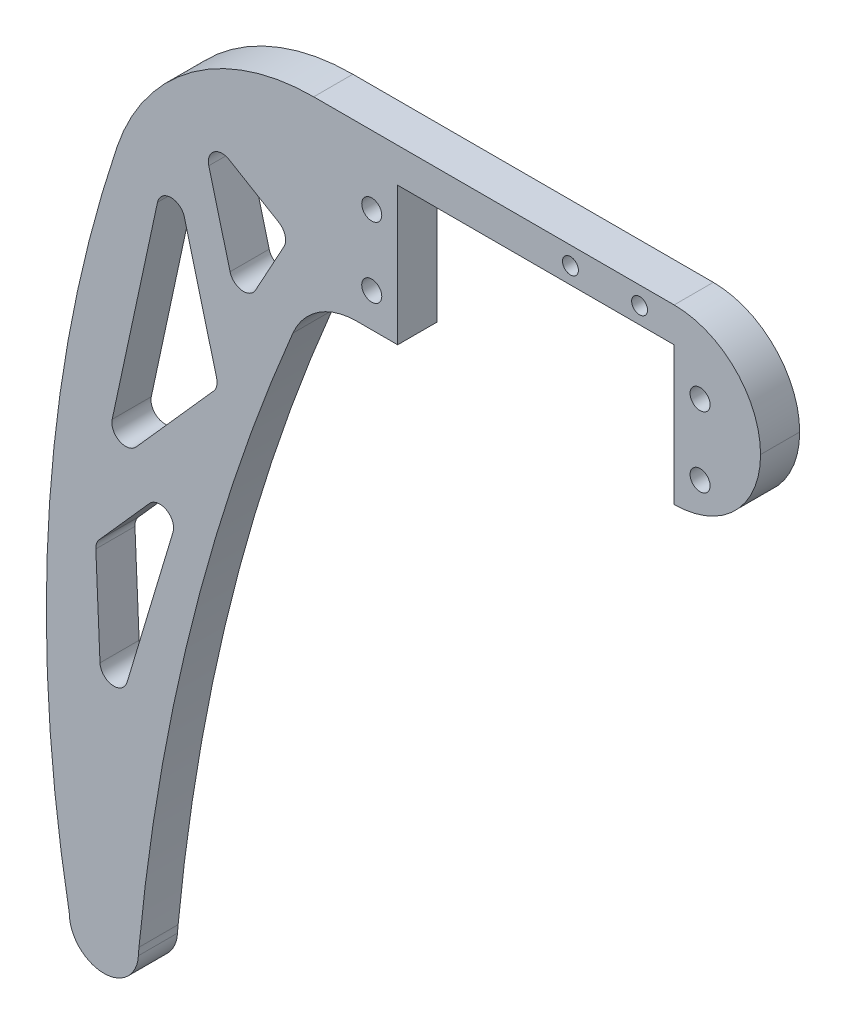
from build123d import *

# Parameters (mm, degrees)
BOSS_EXTRU_1_DEPTH      = 5.66
ENL_V_MAT_EXTRU_1_REACH = 135.062
ESQUISSE2_W             = 40
ESQUISSE2_H             = 20
ENL_V_MAT_EXTRU_2_REACH = 135.062
ESQUISSE3_R             = 1.45
CONG_2_R                = 12.5
CONG_3_R                = 10
CONG_4_R                = 30
CONG_5_R                = 30
ENL_V_MAT_EXTRU_3_REACH = 135.062
CONG_6_R                = 2
ENL_V_MAT_EXTRU_4_REACH = 135.062
ESQUISSE5_R             = 1.15


# Some blends are built 0.0001 mm under size
with BuildPart() as part:
    # Esquisse1 → Boss.-Extru.1 (new body)
    with BuildSketch(Plane.XY):
        with BuildLine():
            Line((-32.5, 12.5), (-52.5, 12.5))
            ThreePointArc((-52.5, 12.5), (-69.287355537, -46.339080558), (-67.5, -107.5))
            ThreePointArc((-67.5, -107.5), (-62.5, -112.5), (-57.5, -107.5))
            ThreePointArc((-57.5, -107.5), (-48.914858734, -58.969774017), (-32.5, -12.5))
            Line((-32.5, -12.5), (32.5, -12.5))
            Line((32.5, -12.5), (32.5, 12.5))
            Line((32.5, 12.5), (-32.5, 12.5))
        make_face()
    extrude(amount=BOSS_EXTRU_1_DEPTH)

    # Esquisse2 → Enlèv. mat.-Extru.1 (cut, up to next)
    with BuildSketch(Plane.XY.offset(5.66), mode=Mode.PRIVATE) as enl_v_mat_extru_1_sk1:
        with Locations((0, -2.5)):
            Rectangle(ESQUISSE2_W, ESQUISSE2_H)
    enl_v_mat_extru_1_tool1 = extrude(enl_v_mat_extru_1_sk1.sketch, amount=-ENL_V_MAT_EXTRU_1_REACH, mode=Mode.PRIVATE) & part.part
    add(enl_v_mat_extru_1_tool1.solids().sort_by_distance((0, -2.5, 5.66))[0], mode=Mode.SUBTRACT)

    # Esquisse3 → Enlèv. mat.-Extru.2 (cut, up to next)
    with BuildSketch(Plane.XY.offset(5.66), mode=Mode.PRIVATE) as enl_v_mat_extru_2_sk1:
        with Locations((-23.75, -7.58)):
            Circle(ESQUISSE3_R)
    enl_v_mat_extru_2_tool1 = extrude(enl_v_mat_extru_2_sk1.sketch, amount=-ENL_V_MAT_EXTRU_2_REACH, mode=Mode.PRIVATE) & part.part
    # Esquisse3 → Enlèv. mat.-Extru.2 (cut, up to next)
    with BuildSketch(Plane.XY.offset(5.66), mode=Mode.PRIVATE) as enl_v_mat_extru_2_sk2:
        with Locations((23.75, -7.58)):
            Circle(ESQUISSE3_R)
    enl_v_mat_extru_2_tool2 = extrude(enl_v_mat_extru_2_sk2.sketch, amount=-ENL_V_MAT_EXTRU_2_REACH, mode=Mode.PRIVATE) & part.part
    # Esquisse3 → Enlèv. mat.-Extru.2 (cut, up to next)
    with BuildSketch(Plane.XY.offset(5.66), mode=Mode.PRIVATE) as enl_v_mat_extru_2_sk3:
        with Locations((23.75, 2.58)):
            Circle(ESQUISSE3_R)
    enl_v_mat_extru_2_tool3 = extrude(enl_v_mat_extru_2_sk3.sketch, amount=-ENL_V_MAT_EXTRU_2_REACH, mode=Mode.PRIVATE) & part.part
    # Esquisse3 → Enlèv. mat.-Extru.2 (cut, up to next)
    with BuildSketch(Plane.XY.offset(5.66), mode=Mode.PRIVATE) as enl_v_mat_extru_2_sk4:
        with Locations((-23.75, 2.58)):
            Circle(ESQUISSE3_R)
    enl_v_mat_extru_2_tool4 = extrude(enl_v_mat_extru_2_sk4.sketch, amount=-ENL_V_MAT_EXTRU_2_REACH, mode=Mode.PRIVATE) & part.part
    add(enl_v_mat_extru_2_tool1.solids().sort_by_distance((-23.75, -7.58, 5.66))[0], mode=Mode.SUBTRACT)
    add(enl_v_mat_extru_2_tool2.solids().sort_by_distance((23.75, -7.58, 5.66))[0], mode=Mode.SUBTRACT)
    add(enl_v_mat_extru_2_tool3.solids().sort_by_distance((23.75, 2.58, 5.66))[0], mode=Mode.SUBTRACT)
    add(enl_v_mat_extru_2_tool4.solids().sort_by_distance((-23.75, 2.58, 5.66))[0], mode=Mode.SUBTRACT)

    # Congé2
    cong_2_edges = [part.edges().sort_by_distance(p)[0] for p in [
        (32.5, -12.5, 2.83),
        (32.5, 12.5, 2.83),
    ]]
    fillet(cong_2_edges, radius=CONG_2_R - 0.0001)  # a hair under: the kernel refuses the full size

    # Congé3
    cong_3_edges = [part.edges().sort_by_distance(p)[0] for p in [
        (-32.5, -12.5, 2.83),
    ]]
    fillet(cong_3_edges, radius=CONG_3_R)

    # Congé4
    cong_4_edges = [part.edges().sort_by_distance(p)[0] for p in [
        (-52.5, 12.5, 2.83),
    ]]
    fillet(cong_4_edges, radius=CONG_4_R)

    # Congé5
    # the kernel refuses this fillet: 30 mm, written as the material it adds along each edge
    with BuildSketch(Plane(origin=(-57.5, -107.5, 0), x_dir=(-0.029294676062998543, -0.9995708188789647, 0), z_dir=(0, 0, 1))) as cong_5_piece_1:
        with BuildLine():
            CenterArc((1.171787043, 29.987124566), CONG_5_R, 266.202223448, 2.119075089)
            ThreePointArc((-0.815268333, 0.053003384), (-0.407652209, 0.026224165), (0, 0))
            ThreePointArc((0, 0), (0.14647338, 0.002145906), (0.292946761, 0))
        make_face()
    extrude(amount=5.66)

    # Esquisse4 → Enlèv. mat.-Extru.3 (cut, up to next)
    with BuildSketch(Plane.XY.offset(5.66), mode=Mode.PRIVATE) as enl_v_mat_extru_3_sk1:
        Polygon((-35.530484253, -6.741676359), (-42.974151572, -20.332321303), (-48.555833289, 0.989708193), align=None)
    enl_v_mat_extru_3_tool1 = extrude(enl_v_mat_extru_3_sk1.sketch, amount=-ENL_V_MAT_EXTRU_3_REACH, mode=Mode.PRIVATE) & part.part
    # Esquisse4 → Enlèv. mat.-Extru.3 (cut, up to next)
    with BuildSketch(Plane.XY.offset(5.66), mode=Mode.PRIVATE) as enl_v_mat_extru_3_sk2:
        Polygon((-52.982896502, -3.816878406), (-45.919055028, -30.800759586), (-62.900626013, -49.913479621), align=None)
    enl_v_mat_extru_3_tool2 = extrude(enl_v_mat_extru_3_sk2.sketch, amount=-ENL_V_MAT_EXTRU_3_REACH, mode=Mode.PRIVATE) & part.part
    # Esquisse4 → Enlèv. mat.-Extru.3 (cut, up to next)
    with BuildSketch(Plane.XY.offset(5.66), mode=Mode.PRIVATE) as enl_v_mat_extru_3_sk3:
        Polygon((-49.898192375, -43.559912364), (-63.702500518, -59.0966302), (-62.552958266, -85.696486809), align=None)
    enl_v_mat_extru_3_tool3 = extrude(enl_v_mat_extru_3_sk3.sketch, amount=-ENL_V_MAT_EXTRU_3_REACH, mode=Mode.PRIVATE) & part.part
    add(enl_v_mat_extru_3_tool1.solids().sort_by_distance((-42.35349, -8.694763, 5.66))[0], mode=Mode.SUBTRACT)
    add(enl_v_mat_extru_3_tool2.solids().sort_by_distance((-53.934193, -28.177039, 5.66))[0], mode=Mode.SUBTRACT)
    add(enl_v_mat_extru_3_tool3.solids().sort_by_distance((-58.717884, -62.784343, 5.66))[0], mode=Mode.SUBTRACT)

    # Congé6
    cong_6_edges = [part.edges().sort_by_distance(p)[0] for p in [
        (-62.900626013, -49.913479621, 2.83),
        (-52.982896502, -3.816878406, 2.83),
        (-45.919055028, -30.800759586, 2.83),
        (-49.898192375, -43.559912364, 2.83),
        (-62.552958266, -85.696486809, 2.83),
        (-63.702500518, -59.0966302, 2.83),
        (-48.555833289, 0.989708193, 2.83),
        (-35.530484253, -6.741676359, 2.83),
        (-42.974151572, -20.332321303, 2.83),
    ]]
    fillet(cong_6_edges, radius=CONG_6_R)

    # Esquisse5 → Enlèv. mat.-Extru.4 (cut, up to next)
    with BuildSketch(Plane.XY.offset(5.66), mode=Mode.PRIVATE) as enl_v_mat_extru_4_sk1:
        with Locations((15, 9.91)):
            Circle(ESQUISSE5_R)
    enl_v_mat_extru_4_tool1 = extrude(enl_v_mat_extru_4_sk1.sketch, amount=-ENL_V_MAT_EXTRU_4_REACH, mode=Mode.PRIVATE) & part.part
    # Esquisse5 → Enlèv. mat.-Extru.4 (cut, up to next)
    with BuildSketch(Plane.XY.offset(5.66), mode=Mode.PRIVATE) as enl_v_mat_extru_4_sk2:
        with Locations((5, 9.91)):
            Circle(ESQUISSE5_R)
    enl_v_mat_extru_4_tool2 = extrude(enl_v_mat_extru_4_sk2.sketch, amount=-ENL_V_MAT_EXTRU_4_REACH, mode=Mode.PRIVATE) & part.part
    add(enl_v_mat_extru_4_tool1.solids().sort_by_distance((15, 9.91, 5.66))[0], mode=Mode.SUBTRACT)
    add(enl_v_mat_extru_4_tool2.solids().sort_by_distance((5, 9.91, 5.66))[0], mode=Mode.SUBTRACT)


solid = part.part
